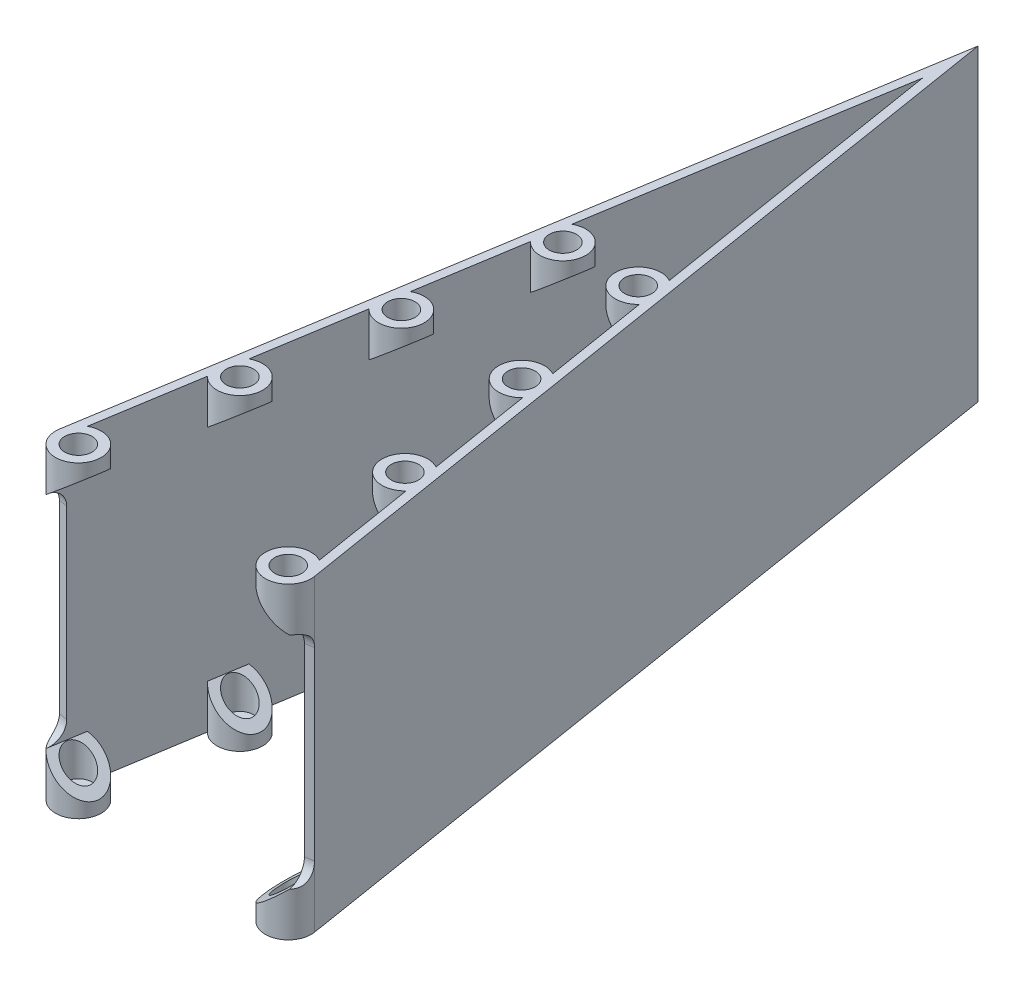
from build123d import *

# Parameters (mm, degrees)
BOSS_EXTRUDE1_DEPTH            = 35
SKETCH2_R                      = 2.6
SKETCH2_R_2                    = 1.55
BOSS_EXTRUDE3_DEPTH            = 5
CUT_EXTRUDE1_REACH             = 101.661
CUT_EXTRUDE1_DIRECTION_2_DEPTH = 100.661000569
CUT_EXTRUDE2_REACH             = 101.661
CUT_EXTRUDE2_DIRECTION_2_DEPTH = 100.661000569
FILLET1_R                      = 2
SKETCH6_R                      = 2.6
BOSS_EXTRUDE4_DEPTH            = 1


with BuildPart() as part:
    # Sketch1 → Boss-Extrude1 (new body)
    with BuildSketch(Plane(origin=(0, 0, 0), x_dir=(1, 0, 0), z_dir=(0, 1, 0))):
        Polygon((-13.5, 0), (0, 83.718518379), (13.5, 0), (14.487246657, 0.15919811), (0, 90), (-14.487246657, 0.15919811), align=None)
    extrude(amount=BOSS_EXTRUDE1_DEPTH)

    # Sketch2 → Boss-Extrude3 (add)
    # profile 1 of 8: a face of its own
    with BuildSketch(Plane(origin=(0, 0, 0), x_dir=(1, 0, 0), z_dir=(0, 1, 0))):
        with Locations((11.920405349, -0.254716975)):
            Circle(SKETCH2_R)
        with Locations(Location((11.920405349, -0.254716975, 0), (0, 0, 270))):
            Circle(SKETCH2_R_2, mode=Mode.SUBTRACT)
    # profile 2 of 8: a face of its own
    with BuildSketch(Plane(origin=(0, 0, 0), x_dir=(1, 0, 0), z_dir=(0, 1, 0))):
        with Locations((9.373235594, 15.541229537)):
            Circle(SKETCH2_R)
        with Locations(Location((9.373235594, 15.541229537, 0), (0, 0, 270))):
            Circle(SKETCH2_R_2, mode=Mode.SUBTRACT)
    # profile 3 of 8: a face of its own
    with BuildSketch(Plane(origin=(0, 0, 0), x_dir=(1, 0, 0), z_dir=(0, 1, 0))):
        with Locations((6.826065839, 31.33717605)):
            Circle(SKETCH2_R)
        with Locations(Location((6.826065839, 31.33717605, 0), (0, 0, 270))):
            Circle(SKETCH2_R_2, mode=Mode.SUBTRACT)
    # profile 4 of 8: a face of its own
    with BuildSketch(Plane(origin=(0, 0, 0), x_dir=(1, 0, 0), z_dir=(0, 1, 0))):
        with Locations((4.278896085, 47.133122563)):
            Circle(SKETCH2_R)
        with Locations(Location((4.278896085, 47.133122563, 0), (0, 0, 270))):
            Circle(SKETCH2_R_2, mode=Mode.SUBTRACT)
    # profile 5 of 8: a face of its own
    with BuildSketch(Plane(origin=(0, 0, 0), x_dir=(1, 0, 0), z_dir=(0, 1, 0))):
        with Locations((-4.278896085, 47.133122563)):
            Circle(SKETCH2_R)
        with Locations(Location((-4.278896085, 47.133122563, 0), (0, 0, 90))):
            Circle(SKETCH2_R_2, mode=Mode.SUBTRACT)
    # profile 6 of 8: a face of its own
    with BuildSketch(Plane(origin=(0, 0, 0), x_dir=(1, 0, 0), z_dir=(0, 1, 0))):
        with Locations((-6.826065839, 31.33717605)):
            Circle(SKETCH2_R)
        with Locations(Location((-6.826065839, 31.33717605, 0), (0, 0, 90))):
            Circle(SKETCH2_R_2, mode=Mode.SUBTRACT)
    # profile 7 of 8: a face of its own
    with BuildSketch(Plane(origin=(0, 0, 0), x_dir=(1, 0, 0), z_dir=(0, 1, 0))):
        with Locations((-9.373235594, 15.541229537)):
            Circle(SKETCH2_R)
        with Locations(Location((-9.373235594, 15.541229537, 0), (0, 0, 90))):
            Circle(SKETCH2_R_2, mode=Mode.SUBTRACT)
    # profile 8 of 8: a face of its own
    with BuildSketch(Plane(origin=(0, 0, 0), x_dir=(1, 0, 0), z_dir=(0, 1, 0))):
        with Locations((-11.920405349, -0.254716975)):
            Circle(SKETCH2_R)
        with Locations(Location((-11.920405349, -0.254716975, 0), (0, 0, 90))):
            Circle(SKETCH2_R_2, mode=Mode.SUBTRACT)
    boss_extrude3 = extrude(amount=BOSS_EXTRUDE3_DEPTH)

    # Cut-Extrude1: up to this face of the body (flat: up to its plane)
    cut_extrude1_end = Plane(part.part.faces().sort_by_distance((-6.691549619, 17.871487916, -42.221731728))[0])
    # Sketch4 → Cut-Extrude1 (cut, up to the picked face)
    with BuildSketch(Plane(origin=(0.342144515, 0, 2.121765321), x_dir=(0.9872466570606503, 0, -0.1591981096702188), z_dir=(0.1591981096702188, 0, 0.9872466570606503)), mode=Mode.PRIVATE) as cut_extrude1_sk1:
        Polygon((13.32782987, 5), (9.12782987, 5), (9.12782987, 1.475781549), align=None)
    cut_extrude1_tool1 = split(extrude(cut_extrude1_sk1.sketch, amount=-CUT_EXTRUDE1_REACH, mode=Mode.PRIVATE), bisect_by=cut_extrude1_end, keep=Keep.BOTH, mode=Mode.PRIVATE)
    cut_extrude1 = cut_extrude1_tool1.solids().sort_by(Axis((10.735709, 3.825261, 0.445755), (-0.1591981096702188, 0, -0.9872466570606503)))[0]
    add(cut_extrude1, mode=Mode.SUBTRACT)

    # Sketch4 → Cut-Extrude1 direction 2 (cut)
    with BuildSketch(Plane(origin=(0.342144515, 0, 2.121765321), x_dir=(0.9872466570606503, 0, -0.1591981096702188), z_dir=(0.1591981096702188, 0, 0.9872466570606503))):
        Polygon((13.32782987, 5), (9.12782987, 5), (9.12782987, 1.475781549), align=None)
    cut_extrude1_direction_2 = extrude(amount=CUT_EXTRUDE1_DIRECTION_2_DEPTH, mode=Mode.SUBTRACT)

    # Cut-Extrude2: up to this face of the body (flat: up to its plane)
    cut_extrude2_end = Plane(part.part.faces().sort_by_distance((6.691549619, 17.871487916, -42.221731728))[0])
    # Sketch5 → Cut-Extrude2 (cut, up to the picked face)
    with BuildSketch(Plane(origin=(-0.342144515, 0, 2.121765321), x_dir=(0.9872466570606502, 0, 0.15919810967021986), z_dir=(-0.15919810967021986, 0, 0.9872466570606502)), mode=Mode.PRIVATE) as cut_extrude2_sk1:
        Polygon((-9.12782987, 5), (-9.12782987, 1.475781549), (-13.32782987, 5), align=None)
    cut_extrude2_tool1 = split(extrude(cut_extrude2_sk1.sketch, amount=-CUT_EXTRUDE2_REACH, mode=Mode.PRIVATE), bisect_by=cut_extrude2_end, keep=Keep.BOTH, mode=Mode.PRIVATE)
    cut_extrude2 = cut_extrude2_tool1.solids().sort_by(Axis((-10.735709, 3.825261, 0.445755), (0.15919810967021986, 0, -0.9872466570606502)))[0]
    add(cut_extrude2, mode=Mode.SUBTRACT)

    # Sketch5 → Cut-Extrude2 direction 2 (cut)
    with BuildSketch(Plane(origin=(-0.342144515, 0, 2.121765321), x_dir=(0.9872466570606502, 0, 0.15919810967021986), z_dir=(-0.15919810967021986, 0, 0.9872466570606502))):
        Polygon((-9.12782987, 5), (-9.12782987, 1.475781549), (-13.32782987, 5), align=None)
    cut_extrude2_direction_2 = extrude(amount=CUT_EXTRUDE2_DIRECTION_2_DEPTH, mode=Mode.SUBTRACT)

    # Mirror2: Boss-Extrude3, Cut-Extrude1, Cut-Extrude1 direction 2, Cut-Extrude2, Cut-Extrude2 direction 2 across plane
    add(boss_extrude3.mirror(Plane.ZX.offset(17.5)))
    add(cut_extrude1.mirror(Plane.ZX.offset(17.5)), mode=Mode.SUBTRACT)
    add(cut_extrude1_direction_2.mirror(Plane.ZX.offset(17.5)), mode=Mode.SUBTRACT)
    add(cut_extrude2.mirror(Plane.ZX.offset(17.5)), mode=Mode.SUBTRACT)
    add(cut_extrude2_direction_2.mirror(Plane.ZX.offset(17.5)), mode=Mode.SUBTRACT)

    # Fillet1
    # the kernel refuses this fillet: 2 mm, written as the material it adds along each edge
    with BuildSketch(Plane(origin=(-19.423479942, 5, -0.955188658), x_dir=(-0.15919810967021975, 0, 0.9872466570606501), z_dir=(0.9872466570606501, 0, 0.15919810967021975))) as fillet1_piece_1_section:
        with BuildLine():
            CenterArc((FILLET1_R, -FILLET1_R), FILLET1_R, 90, 90)
            Line((0, -FILLET1_R), (0, 0))
            Line((0, 0), (FILLET1_R, 0))
        make_face()
    fillet1_piece_1 = extrude(amount=6, mode=Mode.PRIVATE)
    fillet1_piece_1 = fillet1_piece_1 & Plane(origin=(-11.920405349, 5.222362792, 0.254716975), x_dir=(1, 0, 0), z_dir=(0, -1, 0)) * Cylinder(2.6, 21, mode=Mode.PRIVATE)
    add(fillet1_piece_1)
    with BuildSketch(Plane(origin=(13.5, 5, 0), x_dir=(0, 1, 0), z_dir=(0.9872466570606502, 0, -0.15919810967021866))) as fillet1_piece_2_section:
        with BuildLine():
            CenterArc((FILLET1_R, FILLET1_R), FILLET1_R, 180, 90)
            Line((0, FILLET1_R), (0, 0))
            Line((0, 0), (FILLET1_R, 0))
        make_face()
    fillet1_piece_2 = extrude(amount=6, mode=Mode.PRIVATE)
    fillet1_piece_2 = fillet1_piece_2 & Plane(origin=(11.920405349, 5.699977741, 0.254716975), x_dir=(1, 0, 0), z_dir=(0, -1, 0)) * Cylinder(2.6, 20, mode=Mode.PRIVATE)
    add(fillet1_piece_2)
    with BuildSketch(Plane(origin=(13.5, 30, 0), x_dir=(0, -1, 0), z_dir=(0.9872466570606502, 0, -0.15919810967021866))) as fillet1_piece_3_section:
        with BuildLine():
            CenterArc((FILLET1_R, -FILLET1_R), FILLET1_R, 90, 90)
            Line((0, -FILLET1_R), (0, 0))
            Line((0, 0), (FILLET1_R, 0))
        make_face()
    fillet1_piece_3 = extrude(amount=6, mode=Mode.PRIVATE)
    fillet1_piece_3 = fillet1_piece_3 & Plane(origin=(11.920405349, 29.300022259, 0.254716975), x_dir=(1, 0, 0), z_dir=(0, 1, 0)) * Cylinder(2.6, 20, mode=Mode.PRIVATE)
    add(fillet1_piece_3)
    with BuildSketch(Plane(origin=(-19.423479942, 30, -0.955188658), x_dir=(0, -1, 0), z_dir=(0.9872466570606501, 0, 0.15919810967021975))) as fillet1_piece_4_section:
        with BuildLine():
            CenterArc((FILLET1_R, -FILLET1_R), FILLET1_R, 90, 90)
            Line((0, -FILLET1_R), (0, 0))
            Line((0, 0), (FILLET1_R, 0))
        make_face()
    fillet1_piece_4 = extrude(amount=6, mode=Mode.PRIVATE)
    fillet1_piece_4 = fillet1_piece_4 & Plane(origin=(-11.920405349, 29.777637105, 0.254716975), x_dir=(1, 0, 0), z_dir=(0, 1, 0)) * Cylinder(2.6, 21, mode=Mode.PRIVATE)
    add(fillet1_piece_4)

    # Sketch6 → Boss-Extrude4 (add)
    with BuildSketch(Plane.XZ):
        with Locations((11.920405349, 0.254716975)):
            Circle(SKETCH6_R)
        with Locations((9.373235594, -15.541229537)):
            Circle(SKETCH6_R)
        with Locations((6.826065839, -31.33717605)):
            Circle(SKETCH6_R)
        with Locations((4.278896085, -47.133122563)):
            Circle(SKETCH6_R)
        with Locations((-4.278896085, -47.133122563)):
            Circle(SKETCH6_R)
        with Locations((-6.826065839, -31.33717605)):
            Circle(SKETCH6_R)
        with Locations((-9.373235594, -15.541229537)):
            Circle(SKETCH6_R)
        with Locations((-11.920405349, 0.254716975)):
            Circle(SKETCH6_R)
    extrude(amount=-BOSS_EXTRUDE4_DEPTH)


solid = part.part
